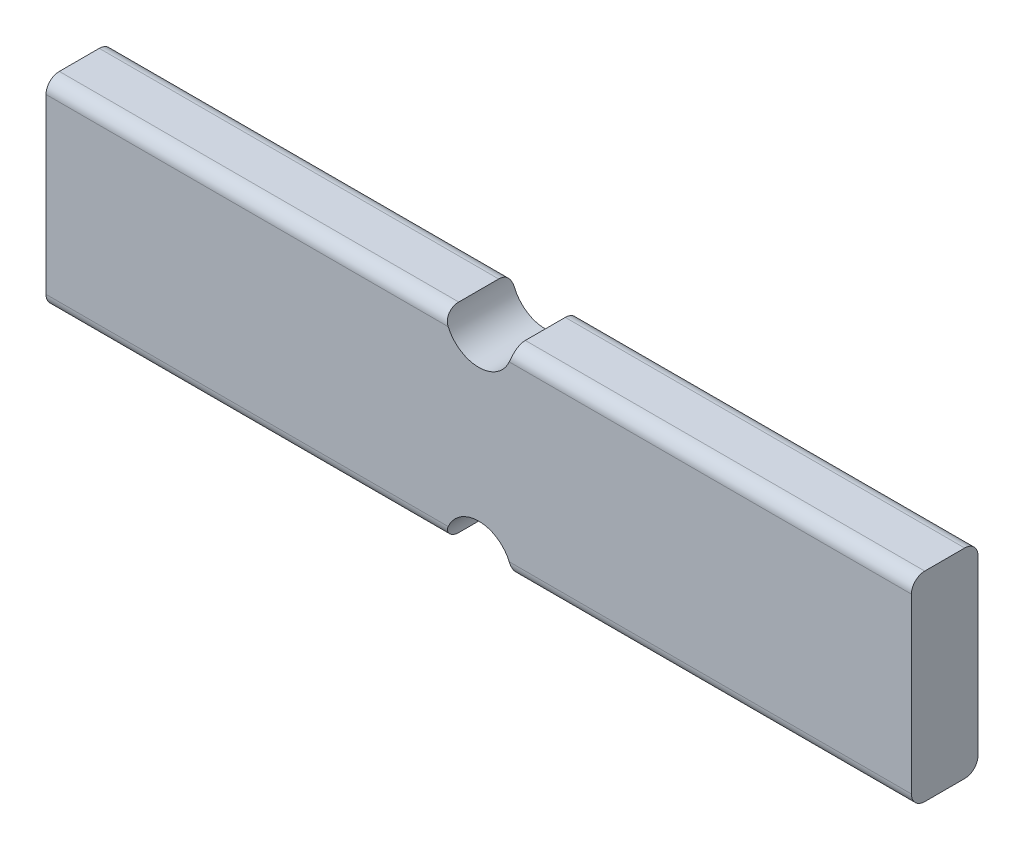
from build123d import *

# Parameters (mm, degrees)
EXTRUDE1_DEPTH = 12.7
FILLET1_R      = 2.54


with BuildPart() as part:
    # Sketch1 → Extrude1 (new body)
    with BuildSketch(Plane.XY):
        with BuildLine():
            Line((0, 0), (76.2, 0))
            ThreePointArc((76.2, 0), (82.55, 6.35), (88.9, 0))
            Line((88.9, 0), (165.1, 0))
            Line((165.1, 0), (165.1, 38.1))
            Line((165.1, 38.1), (88.9, 38.1))
            ThreePointArc((88.9, 38.1), (82.55, 31.75), (76.2, 38.1))
            Line((76.2, 38.1), (0, 38.1))
            Line((0, 38.1), (0, 0))
        make_face()
    extrude(amount=EXTRUDE1_DEPTH)

    # Fillet1
    fillet1_edges = [part.edges().sort_by_distance(p)[0] for p in [
        (127, 0, 0),
        (38.1, 0, 0),
        (127, 0, 12.7),
        (38.1, 0, 12.7),
        (127, 38.1, 12.7),
        (127, 38.1, 0),
        (38.1, 38.1, 0),
        (38.1, 38.1, 12.7),
    ]]
    fillet(fillet1_edges, radius=FILLET1_R)


solid = part.part
